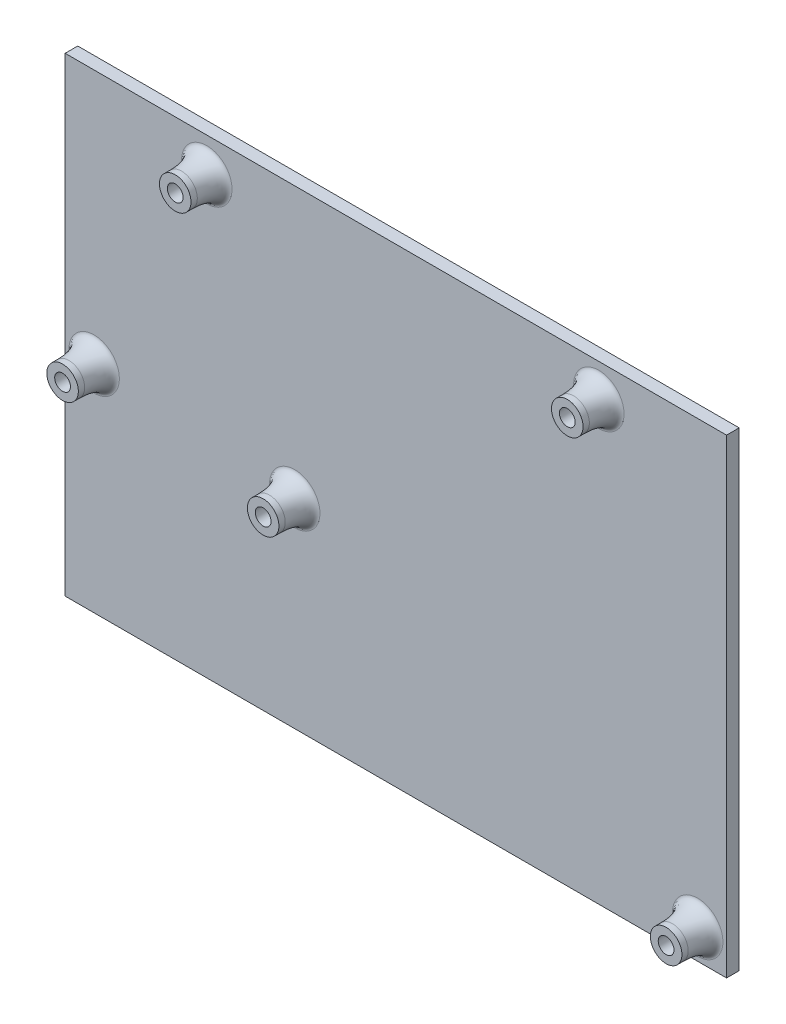
from build123d import *

# Parameters (mm, degrees)
SKETCH1_W           = 100.85
SKETCH1_H           = 70.53
BOSS_EXTRUDE1_DEPTH = 2
SKETCH6_W           = 104.85
SKETCH6_H           = 74.53
BOSS_EXTRUDE3_DEPTH = 2
SKETCH3_R           = 2.5
BOSS_EXTRUDE2_DEPTH = 5
FILLET1_SIZE        = 1.5
FILLET1_SIZE_2      = 4


with BuildPart() as part:
    # Sketch1 → Boss-Extrude1 (new body)
    with BuildSketch(Plane.XY):
        with Locations((0.782139599, -9.454393248)):
            Rectangle(SKETCH1_W, SKETCH1_H)
    extrude(amount=BOSS_EXTRUDE1_DEPTH)

    # Sketch6 → Boss-Extrude3 (add)
    with BuildSketch(Plane.XY.offset(2)):
        with Locations((0.782139599, -9.454393248)):
            Rectangle(SKETCH6_W, SKETCH6_H)
    extrude(amount=-BOSS_EXTRUDE3_DEPTH)

    # Sketch3 → Boss-Extrude2 (add)
    with BuildSketch(Plane.XY.offset(2)):
        with Locations((-29.192860401, 22.360606752)):
            Circle(SKETCH3_R)
    boss_extrude2 = extrude(amount=BOSS_EXTRUDE2_DEPTH)

    # Sketch5 → Tap Drill for M3x0.5 Tap1 (revolve, cut)
    with BuildSketch(Plane(origin=(-29.192860401, 22.360606752, 7), x_dir=(0, -1, 0), z_dir=(1, 0, 0))):
        Polygon((0, 0), (0, 10.751075774), (1.25, 10), (1.25, 0), align=None)
    tap_drill_for_m3x0_5_tap1 = revolve(axis=Axis((-29.192860401, 22.360606752, 13.35), (0, 0, -1)), mode=Mode.SUBTRACT)

    # Sketch-Pattern1: Boss-Extrude2, Tap Drill for M3x0.5 Tap1 at 4 more places
    with Locations((-17.86, -34.92, 0), (13.94, -37.51, 0), (77.82, -64.41, 0), (62.15, 0.23, 0)):
        add(boss_extrude2)
        add(tap_drill_for_m3x0_5_tap1, mode=Mode.SUBTRACT)

    # Fillet1
    # an asymmetric fillet: 4, 1.5 mm, written as the material it adds along each edge
    with BuildSketch(Plane(origin=(-29.192860401, 22.360606752, 2), x_dir=(1, 0, 0), z_dir=(0, -1, 0))) as fillet1_piece_1:
        with BuildLine():
            Bezier((2.5 + FILLET1_SIZE, 0), (2.5, 0), (2.5, FILLET1_SIZE_2), weights=[1, 0.707106781, 1])
            Line((2.5, FILLET1_SIZE_2), (2.5, 0))
            Line((2.5, 0), (2.5 + FILLET1_SIZE, 0))
        make_face()
    revolve(axis=Axis((-29.192860401, 22.360606752, 2), (0, 0, 1)))
    with BuildSketch(Plane(origin=(-47.052860401, -12.559393248, 2), x_dir=(1, 0, 0), z_dir=(0, -1, 0))) as fillet1_piece_2:
        with BuildLine():
            Bezier((2.5 + FILLET1_SIZE, 0), (2.5, 0), (2.5, FILLET1_SIZE_2), weights=[1, 0.707106781, 1])
            Line((2.5, FILLET1_SIZE_2), (2.5, 0))
            Line((2.5, 0), (2.5 + FILLET1_SIZE, 0))
        make_face()
    revolve(axis=Axis((-47.052860401, -12.559393248, 2), (0, 0, 1)))
    with BuildSketch(Plane(origin=(-15.252860401, -15.149393248, 2), x_dir=(1, 0, 0), z_dir=(0, -1, 0))) as fillet1_piece_3:
        with BuildLine():
            Bezier((2.5 + FILLET1_SIZE, 0), (2.5, 0), (2.5, FILLET1_SIZE_2), weights=[1, 0.707106781, 1])
            Line((2.5, FILLET1_SIZE_2), (2.5, 0))
            Line((2.5, 0), (2.5 + FILLET1_SIZE, 0))
        make_face()
    revolve(axis=Axis((-15.252860401, -15.149393248, 2), (0, 0, 1)))
    with BuildSketch(Plane(origin=(48.627139599, -42.049393248, 2), x_dir=(1, 0, 0), z_dir=(0, -1, 0))) as fillet1_piece_4:
        with BuildLine():
            Bezier((2.5 + FILLET1_SIZE, 0), (2.5, 0), (2.5, FILLET1_SIZE_2), weights=[1, 0.707106781, 1])
            Line((2.5, FILLET1_SIZE_2), (2.5, 0))
            Line((2.5, 0), (2.5 + FILLET1_SIZE, 0))
        make_face()
    revolve(axis=Axis((48.627139599, -42.049393248, 2), (0, 0, 1)))
    with BuildSketch(Plane(origin=(32.957139599, 22.590606752, 2), x_dir=(1, 0, 0), z_dir=(0, -1, 0))) as fillet1_piece_5:
        with BuildLine():
            Bezier((2.5 + FILLET1_SIZE, 0), (2.5, 0), (2.5, FILLET1_SIZE_2), weights=[1, 0.707106781, 1])
            Line((2.5, FILLET1_SIZE_2), (2.5, 0))
            Line((2.5, 0), (2.5 + FILLET1_SIZE, 0))
        make_face()
    revolve(axis=Axis((32.957139599, 22.590606752, 2), (0, 0, 1)))


solid = part.part
